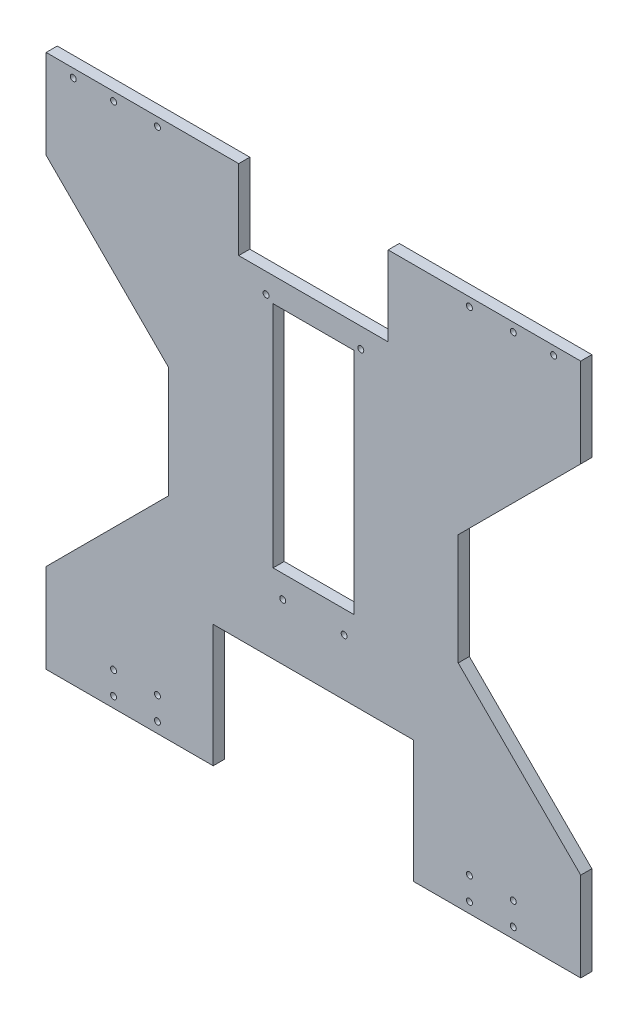
from build123d import *

# Parameters (mm, degrees)
SKETCH1_W              = 304.8
SKETCH1_H              = 304.622712027
BOSS_EXTRUDE1_DEPTH    = 6.35
CUT_EXTRUDE1_START     = -6.35
CUT_EXTRUDE1_OUTLINE_R = 1.7
CUT_EXTRUDE1_OUTLINE_W = 46
CUT_EXTRUDE1_OUTLINE_H = 130.477204634
CUT_EXTRUDE1_DEPTH     = 6.35
SKETCH4_W              = 85.216118386
SKETCH4_H              = 49.623018197
CUT_EXTRUDE2_DEPTH     = 10
SKETCH5_R              = 1.7
CUT_EXTRUDE3_DEPTH     = 21
SKETCH6_R              = 1.7
CUT_EXTRUDE4_DEPTH     = 21
SKETCH7_W              = 114.3
SKETCH7_H              = 69.85
CUT_EXTRUDE5_DEPTH     = 10


# Read off the part's stored shape, not the designer's step: Cut-Extrude1
with BuildPart() as part:
    # Sketch1 → Boss-Extrude1 (new body)
    with BuildSketch(Plane.XY):
        with Locations((152.4, 152.311356014)):
            Rectangle(SKETCH1_W, SKETCH1_H)
    extrude(amount=BOSS_EXTRUDE1_DEPTH)

    # Cut-Extrude1 outline → Cut-Extrude1 (cut)
    with BuildSketch(Plane.XY.offset(6.35).offset(CUT_EXTRUDE1_START)):
        with Locations((169.9, 101.950028876)):
            Circle(CUT_EXTRUDE1_OUTLINE_R)
        with Locations((152.4, 180.037397769)):
            Rectangle(CUT_EXTRUDE1_OUTLINE_W, CUT_EXTRUDE1_OUTLINE_H)
        with Locations((125.4, 247.82572008)):
            Circle(CUT_EXTRUDE1_OUTLINE_R)
        with Locations((179.4, 247.82572008)):
            Circle(CUT_EXTRUDE1_OUTLINE_R)
        with Locations((134.9, 101.950028876)):
            Circle(CUT_EXTRUDE1_OUTLINE_R)
    extrude(amount=CUT_EXTRUDE1_DEPTH, mode=Mode.SUBTRACT)

    # Sketch4 → Cut-Extrude2 (cut)
    with BuildSketch(Plane(origin=(0, 0, 0), x_dir=(-1, 0, 0), z_dir=(0, 0, -1))):
        with Locations((-152.4, 284.018084638)):
            Rectangle(SKETCH4_W, SKETCH4_H)
    extrude(amount=-CUT_EXTRUDE2_DEPTH, mode=Mode.SUBTRACT)

    # Sketch5 → Cut-Extrude3 (cut)
    with BuildSketch(Plane.XY.offset(6.35)):
        with Locations((241.35, 299.711356013)):
            Circle(SKETCH5_R)
        with Locations((266.35, 299.711356013)):
            Circle(SKETCH5_R)
        with Locations((38.45, 299.711356013)):
            Circle(SKETCH5_R)
        with Locations((63.45, 299.711356013)):
            Circle(SKETCH5_R)
        with Locations((241.35, 19.000000001)):
            Circle(SKETCH5_R)
        with Locations((241.35, 6.000000001)):
            Circle(SKETCH5_R)
        with Locations((266.35, 19.000000001)):
            Circle(SKETCH5_R)
        with Locations((266.35, 6.000000001)):
            Circle(SKETCH5_R)
        with Locations((63.45, 6)):
            Circle(SKETCH5_R)
        with Locations((38.45, 6)):
            Circle(SKETCH5_R)
        with Locations((63.45, 19)):
            Circle(SKETCH5_R)
        with Locations((38.45, 19)):
            Circle(SKETCH5_R)
    extrude(amount=-CUT_EXTRUDE3_DEPTH, mode=Mode.SUBTRACT)

    # Sketch6 → Cut-Extrude4 (cut)
    with BuildSketch(Plane.XY.offset(6.35)):
        with Locations((289.349981069, 299.740865879)):
            Circle(SKETCH6_R)
        with Locations((15.45, 299.711356012)):
            Circle(SKETCH6_R)
    extrude(amount=-CUT_EXTRUDE4_DEPTH, mode=Mode.SUBTRACT)

    # Sketch7 → Cut-Extrude5 (cut)
    with BuildSketch(Plane.XY.offset(6.35)):
        Polygon((0, 253.822712027), (0, 50.8), (69.85, 120.65), (69.85, 183.972712027), align=None)
        with Locations((152.4, 34.925)):
            Rectangle(SKETCH7_W, SKETCH7_H)
        Polygon((234.95, 120.65), (304.8, 50.8), (304.8, 253.822712027), (234.95, 183.972712027), align=None)
    extrude(amount=-CUT_EXTRUDE5_DEPTH, mode=Mode.SUBTRACT)


solid = part.part
